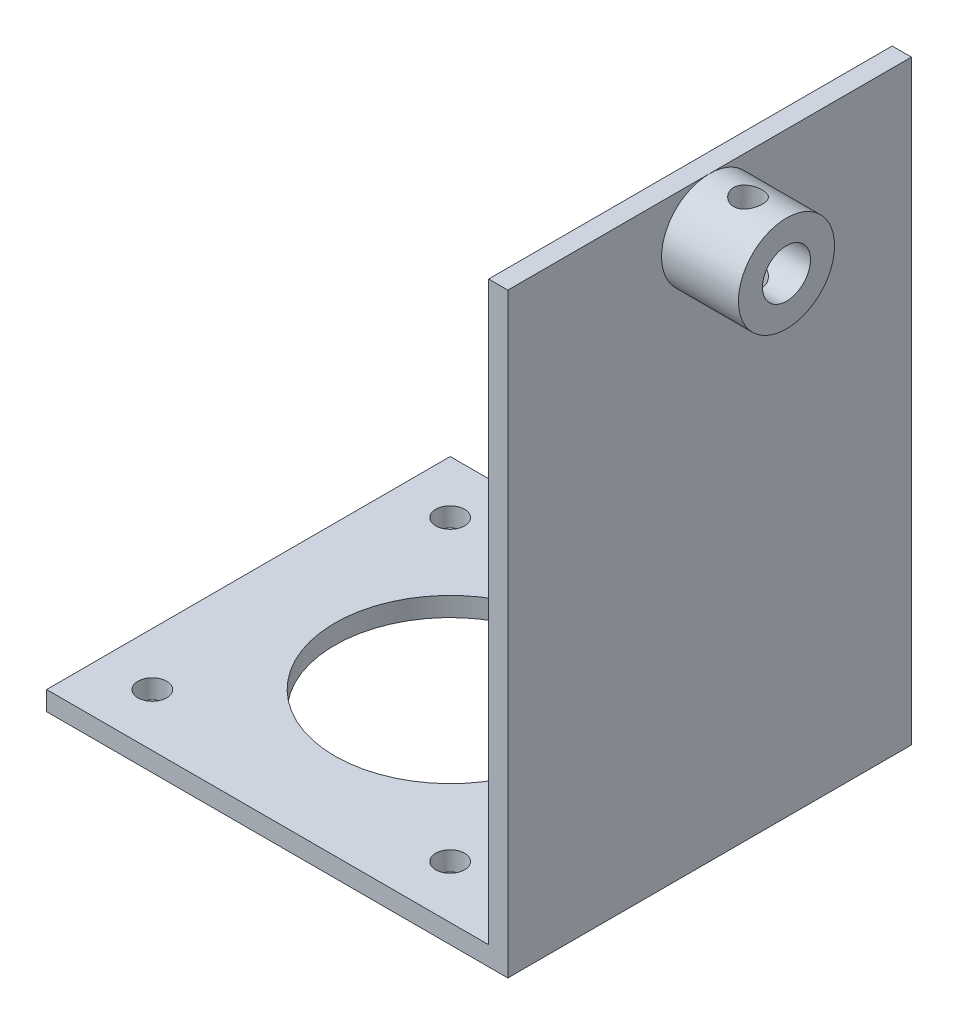
from build123d import *

# Parameters (mm, degrees)
SKETCH_1_W          = 48
SKETCH_1_H          = 42
EXTRUDE_1_DEPTH     = 2
SKETCH_2_R          = 12
SKETCH_2_R_2        = 1.5
CUT_EXTRUDE_1_DEPTH = 2
SKETCH_9_W          = 2
SKETCH_9_H          = 42
EXTRUDE_7_DEPTH     = 60
EXTRUDE_9_DEPTH     = 8
SKETCH_11_R         = 2.5
CUT_EXTRUDE_4_DEPTH = 10
SKETCH_12_R         = 1.5
CUT_EXTRUDE_6_DEPTH = 94.50935782


with BuildPart() as part:
    # 草图1 → 凸台-拉伸1 (new body)
    with BuildSketch(Plane(origin=(0, 0, 0), x_dir=(1, 0, 0), z_dir=(0, 1, 0))):
        with Locations((24, 21)):
            Rectangle(SKETCH_1_W, SKETCH_1_H)
    extrude(amount=EXTRUDE_1_DEPTH)

    # 草图2 → 切除-拉伸1 (cut)
    with BuildSketch(Plane(origin=(0, 2, 0), x_dir=(1, 0, 0), z_dir=(0, 1, 0))):
        with Locations((21, 21)):
            Circle(SKETCH_2_R)
        with Locations((36.5, 36.5)):
            Circle(SKETCH_2_R_2)
        with Locations((36.5, 5.5)):
            Circle(SKETCH_2_R_2)
        with Locations((5.5, 5.5)):
            Circle(SKETCH_2_R_2)
        with Locations((5.5, 36.5)):
            Circle(SKETCH_2_R_2)
    extrude(amount=-CUT_EXTRUDE_1_DEPTH, mode=Mode.SUBTRACT)

    # 草图9 → 凸台-拉伸7 (add)
    with BuildSketch(Plane(origin=(0, 2, 0), x_dir=(1, 0, 0), z_dir=(0, 1, 0))):
        with Locations((47, 21)):
            Rectangle(SKETCH_9_W, SKETCH_9_H)
    extrude(amount=EXTRUDE_7_DEPTH)

    # 草图10 → 凸台-拉伸9 (add)
    with BuildSketch(Plane(origin=(48, 0, 0), x_dir=(0, 0, -1), z_dir=(1, 0, 0))):
        with BuildLine():
            ThreePointArc((21, 62), (17.464466094, 53.464466094), (26, 57))
            ThreePointArc((26, 57), (24.535533906, 60.535533906), (21, 62))
        make_face()
    extrude(amount=EXTRUDE_9_DEPTH)

    # 草图11 → 切除-拉伸4 (cut)
    with BuildSketch(Plane(origin=(56, 0, 0), x_dir=(0, 0, -1), z_dir=(1, 0, 0))):
        with Locations((21, 57)):
            Circle(SKETCH_11_R)
    extrude(amount=-CUT_EXTRUDE_4_DEPTH, mode=Mode.SUBTRACT)

    # 草图12 → 切除-拉伸6 (cut, through all)
    with BuildSketch(Plane(origin=(0, 0, 0), x_dir=(1, 0, 0), z_dir=(0, 1, 0))):
        with Locations((52, 21)):
            Circle(SKETCH_12_R)
    extrude(amount=CUT_EXTRUDE_6_DEPTH, mode=Mode.SUBTRACT)


solid = part.part
